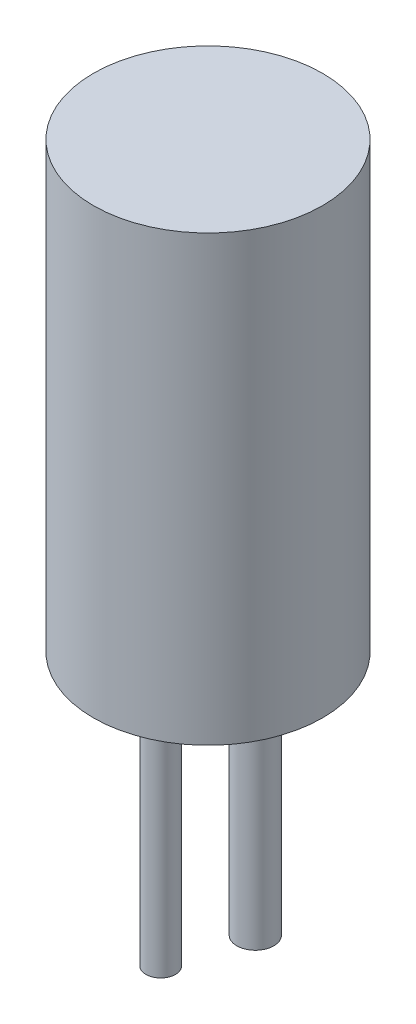
from build123d import *

# Parameters (mm, degrees)
SKETCH_1_R      = 3.1
EXTRUDE_1_DEPTH = 12
SKETCH_2_R      = 0.4
EXTRUDE_2_DEPTH = 8
SKETCH_3_R      = 0.5
EXTRUDE_3_DEPTH = 6


with BuildPart() as part:
    # 草图1 → 拉伸1 (new body)
    with BuildSketch(Plane(origin=(0, 0, 0), x_dir=(1, 0, 0), z_dir=(0, 1, 0))):
        Circle(SKETCH_1_R)
    extrude(amount=EXTRUDE_1_DEPTH)

    # 草图2 → 拉伸2 (add)
    with BuildSketch(Plane.XZ):
        with Locations((-1.28, 0)):
            Circle(SKETCH_2_R)
    extrude(amount=EXTRUDE_2_DEPTH)

    # 草图3 → 拉伸3 (add)
    with BuildSketch(Plane.XZ):
        with Locations((1.28, 0)):
            Circle(SKETCH_3_R)
    extrude(amount=EXTRUDE_3_DEPTH)


solid = part.part
